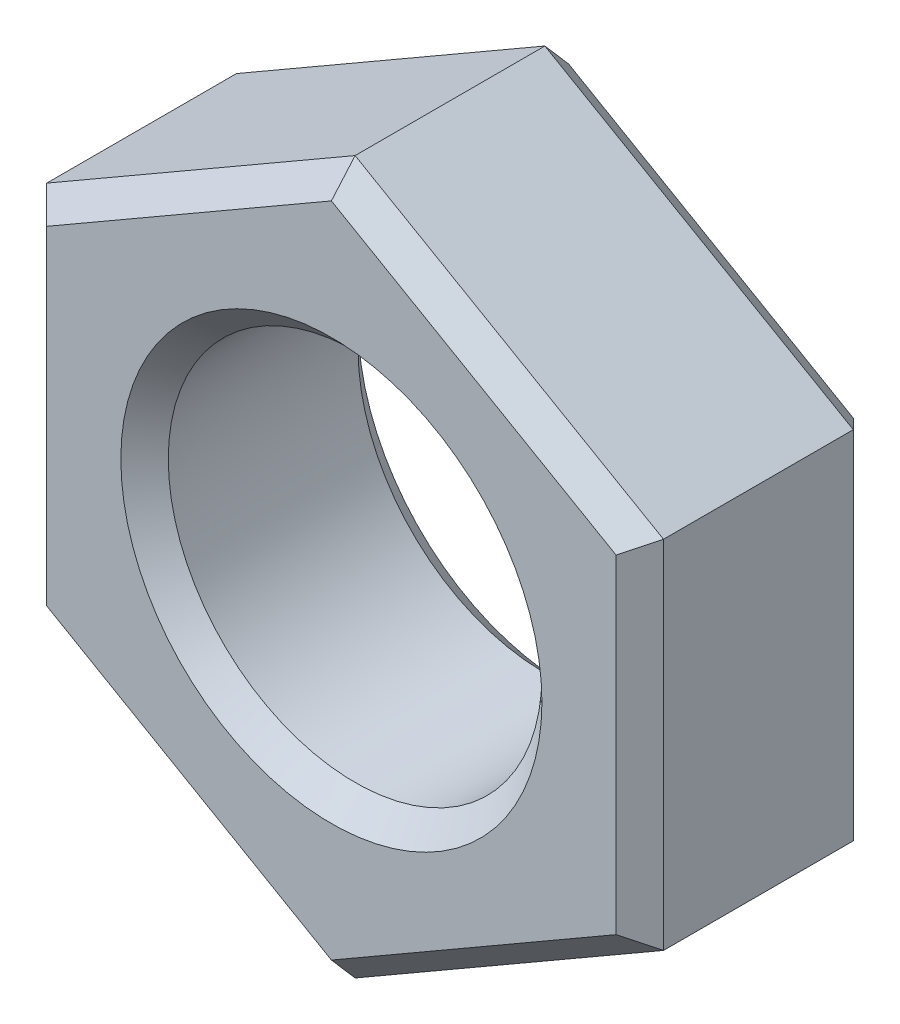
from build123d import *

# Parameters (mm, degrees)
SKETCH1_R           = 1.575
BOSS_EXTRUDE1_DEPTH = 1
DEBURS_SIZE         = 0.2


with BuildPart() as part:
    # Sketch1 → Boss-Extrude1 (new, symmetric)
    with BuildSketch(Plane.XY):
        Polygon((2.6, -1.5011107), (2.6, 1.5011107), (0, 3.0022214), (-2.6, 1.5011107), (-2.6, -1.5011107), (0, -3.0022214), align=None)
        Circle(SKETCH1_R, mode=Mode.SUBTRACT)
    extrude(amount=BOSS_EXTRUDE1_DEPTH, both=True)

    # Deburs
    deburs_edges = [part.edges().sort_by_distance(p)[0] for p in [
        (-1.575, 0, -1),
        (2.6, 0, -1),
        (1.3, 2.25166605, -1),
        (-1.3, 2.25166605, -1),
        (-2.6, 0, -1),
        (-1.3, -2.25166605, -1),
        (1.3, -2.25166605, -1),
        (-1.575, 0, 1),
        (-1.3, -2.25166605, 1),
        (-2.6, 0, 1),
        (-1.3, 2.25166605, 1),
        (1.3, 2.25166605, 1),
        (2.6, 0, 1),
        (1.3, -2.25166605, 1),
    ]]
    chamfer(deburs_edges, length=DEBURS_SIZE)


solid = part.part
